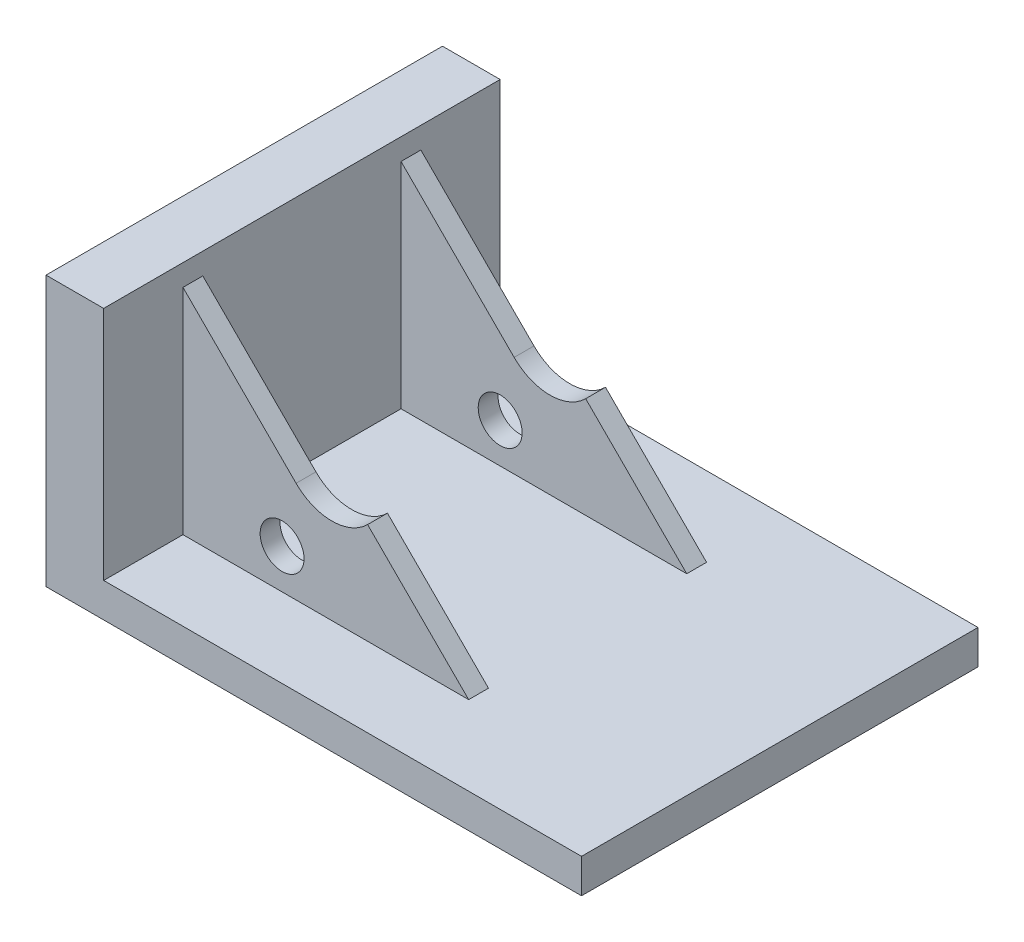
from build123d import *

# Parameters (mm, degrees)
BOSS_EXTRU_1_DEPTH = 50
NERVURE1_START     = -5
NERVURE1_DEPTH     = 5
D_GAGEMENT_51_D    = 11.0744


# Read off the part's stored shape, not the designer's step: Nervure1
with BuildPart() as part:
    # Esquisse1 → Boss.-Extru.1 (new, symmetric)
    with BuildSketch(Plane.XY):
        Polygon((-67.326566733, 0), (67.742162824, 0), (67.742162824, 8.623618887), (-52.78070355, 8.623618887), (-52.78070355, 68.053859892), (-67.326566733, 68.053859892), align=None)
    extrude(amount=BOSS_EXTRU_1_DEPTH, both=True)

    # Nervure1 outline → Nervure1 (add)
    with BuildSketch(Plane.XY.offset(30).offset(NERVURE1_START)):
        with BuildLine():
            Line((19.279550654, 8.623618887), (-6.210494082, 34.113663623))
            ThreePointArc((-6.210494082, 34.113663623), (-15.230796531, 30.377332012), (-24.251098981, 34.113663623))
            Line((-24.251098981, 34.113663623), (-52.78070355, 62.643268192))
            Line((-52.78070355, 62.643268192), (-52.78070355, 8.623618887))
            Line((-52.78070355, 8.623618887), (19.279550654, 8.623618887))
        make_face()
    nervure1 = extrude(amount=NERVURE1_DEPTH)

    # Symétrie1: Nervure1 across plane
    add(nervure1.mirror(Plane.XY))

    # Dégagement #51 (through all)
    with Locations(Plane(origin=(0, 0, -30), x_dir=(-1, 0, 0), z_dir=(0, 0, -1))):
        with Locations((27.78070355, 18.623618887)):
            Hole(D_GAGEMENT_51_D / 2)


solid = part.part
